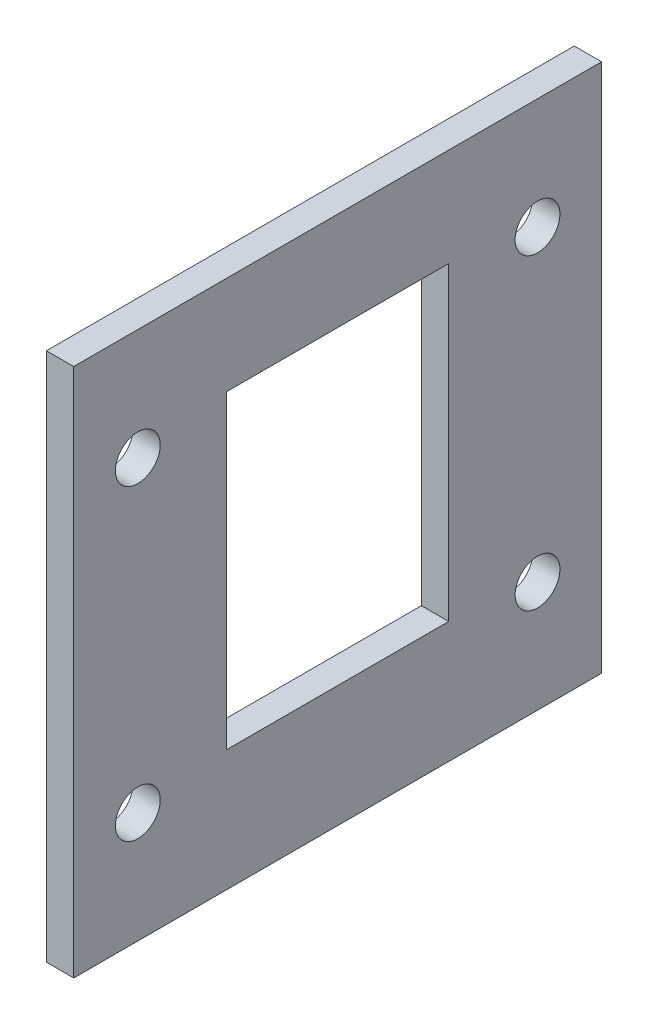
from build123d import *

# Parameters (mm, degrees)
SKETCH1_W           = 61.8
SKETCH1_H           = 62
BOSS_EXTRUDE1_DEPTH = 3.2
CUT_EXTRUDE1_REACH  = 89.598
SKETCH2_W           = 26
SKETCH2_H           = 36.3
CUT_EXTRUDE2_REACH  = 89.598
SKETCH3_R           = 2.625


with BuildPart() as part:
    # Sketch1 → Boss-Extrude1 (new body)
    with BuildSketch(Plane(origin=(0, 0, 0), x_dir=(0, 0, -1), z_dir=(1, 0, 0))):
        with Locations((30.9, 31)):
            Rectangle(SKETCH1_W, SKETCH1_H)
    extrude(amount=BOSS_EXTRUDE1_DEPTH)

    # Sketch2 → Cut-Extrude1 (cut, up to next)
    with BuildSketch(Plane(origin=(3.2, 0, 0), x_dir=(0, 0, -1), z_dir=(1, 0, 0)), mode=Mode.PRIVATE) as cut_extrude1_sk1:
        with Locations((30.9, 32.35)):
            Rectangle(SKETCH2_W, SKETCH2_H)
    cut_extrude1_tool1 = extrude(cut_extrude1_sk1.sketch, amount=-CUT_EXTRUDE1_REACH, mode=Mode.PRIVATE) & part.part
    add(cut_extrude1_tool1.solids().sort_by_distance((3.2, 32.35, -30.9))[0], mode=Mode.SUBTRACT)

    # Sketch3 → Cut-Extrude2 (cut, up to next)
    with BuildSketch(Plane.ZY, mode=Mode.PRIVATE) as cut_extrude2_sk1:
        with Locations((-7.5, 49)):
            Circle(SKETCH3_R)
    cut_extrude2_tool1 = extrude(cut_extrude2_sk1.sketch, amount=-CUT_EXTRUDE2_REACH, mode=Mode.PRIVATE) & part.part
    # Sketch3 → Cut-Extrude2 (cut, up to next)
    with BuildSketch(Plane.ZY, mode=Mode.PRIVATE) as cut_extrude2_sk2:
        with Locations((-7.5, 13)):
            Circle(SKETCH3_R)
    cut_extrude2_tool2 = extrude(cut_extrude2_sk2.sketch, amount=-CUT_EXTRUDE2_REACH, mode=Mode.PRIVATE) & part.part
    # Sketch3 → Cut-Extrude2 (cut, up to next)
    with BuildSketch(Plane.ZY, mode=Mode.PRIVATE) as cut_extrude2_sk3:
        with Locations((-54.3, 49)):
            Circle(SKETCH3_R)
    cut_extrude2_tool3 = extrude(cut_extrude2_sk3.sketch, amount=-CUT_EXTRUDE2_REACH, mode=Mode.PRIVATE) & part.part
    # Sketch3 → Cut-Extrude2 (cut, up to next)
    with BuildSketch(Plane.ZY, mode=Mode.PRIVATE) as cut_extrude2_sk4:
        with Locations((-54.3, 13)):
            Circle(SKETCH3_R)
    cut_extrude2_tool4 = extrude(cut_extrude2_sk4.sketch, amount=-CUT_EXTRUDE2_REACH, mode=Mode.PRIVATE) & part.part
    add(cut_extrude2_tool1.solids().sort_by_distance((0, 49, -7.5))[0], mode=Mode.SUBTRACT)
    add(cut_extrude2_tool2.solids().sort_by_distance((0, 13, -7.5))[0], mode=Mode.SUBTRACT)
    add(cut_extrude2_tool3.solids().sort_by_distance((0, 49, -54.3))[0], mode=Mode.SUBTRACT)
    add(cut_extrude2_tool4.solids().sort_by_distance((0, 13, -54.3))[0], mode=Mode.SUBTRACT)


solid = part.part
